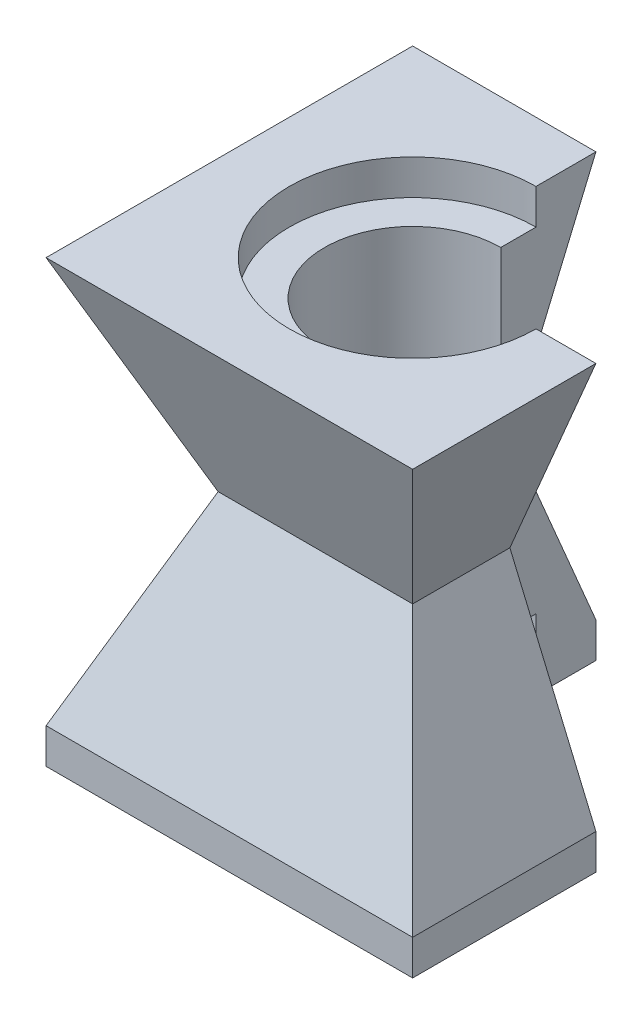
from build123d import *

# Parameters (mm, degrees)
SKETCH1_W           = 104
SKETCH1_H           = 104
BOSS_EXTRUDE1_DEPTH = 57.5
BOSS_EXTRUDE1_TAPER = 23
SKETCH1_3_R         = 25
CUT_EXTRUDE1_DEPTH  = 137.502747386
CUT_EXTRUDE2_DEPTH  = 10
CUT_EXTRUDE3_DEPTH  = 137.502747386
CUT_EXTRUDE4_DEPTH  = 10
BOSS_EXTRUDE2_DEPTH = 10


with BuildPart() as part:
    # Sketch1 → Boss-Extrude1 (new body)
    with BuildSketch(Plane(origin=(0, 0, 0), x_dir=(1, 0, 0), z_dir=(0, 1, 0))):
        Rectangle(SKETCH1_W, SKETCH1_H)
    boss_extrude1 = extrude(amount=BOSS_EXTRUDE1_DEPTH, taper=BOSS_EXTRUDE1_TAPER)

    # Mirror1: Boss-Extrude1 across plane
    add(boss_extrude1.mirror(Plane.ZX.offset(57.5)))

    # Sketch1<3> → Cut-Extrude1 (cut, through all)
    with BuildSketch(Plane(origin=(0, 0, 0), x_dir=(1, 0, 0), z_dir=(0, 1, 0))):
        Circle(SKETCH1_3_R)
    extrude(amount=CUT_EXTRUDE1_DEPTH, mode=Mode.SUBTRACT)

    # Sketch2 → Cut-Extrude2 (cut)
    with BuildSketch(Plane.XZ):
        with BuildLine():
            Line((0, -35), (0, -25))
            ThreePointArc((0, -25), (-17.67766953, 17.67766953), (25, 0))
            Line((25, 0), (35, 0))
            ThreePointArc((35, 0), (-24.748737342, 24.748737342), (0, -35))
        make_face()
    cut_extrude2 = extrude(amount=-CUT_EXTRUDE2_DEPTH, mode=Mode.SUBTRACT)

    # Sketch2<3> → Cut-Extrude3 (cut, through all)
    with BuildSketch(Plane.XZ):
        with BuildLine():
            Line((0, -25), (0, -35))
            Line((0, -35), (0, -52))
            Line((0, -52), (52, -52))
            Line((52, -52), (52, 0))
            Line((52, 0), (35, 0))
            Line((35, 0), (25, 0))
            ThreePointArc((25, 0), (17.67766953, -17.67766953), (0, -25))
        make_face()
    extrude(amount=-CUT_EXTRUDE3_DEPTH, mode=Mode.SUBTRACT)

    # Mirror2: Cut-Extrude2 across plane
    add(cut_extrude2.mirror(Plane(origin=(0, 57.5, 0), x_dir=(0, 0, 1), z_dir=(0, -1, 0))), mode=Mode.SUBTRACT)

    # Sketch3 → Cut-Extrude4 (cut)
    with BuildSketch(Plane.XZ):
        with BuildLine():
            Line((32.173358544, 27.930717857), (42.779960262, 38.537319575))
            ThreePointArc((42.779960262, 38.537319575), (42.779960262, 42.779960262), (38.537319575, 42.779960262))
            Line((38.537319575, 42.779960262), (27.930717857, 32.173358544))
            ThreePointArc((27.930717857, 32.173358544), (27.930717857, 27.930717857), (32.173358544, 27.930717857))
        make_face()
        with BuildLine():
            Line((-32.173358544, -27.930717857), (-42.779960262, -38.537319575))
            ThreePointArc((-42.779960262, -38.537319575), (-42.779960262, -42.779960262), (-38.537319575, -42.779960262))
            Line((-38.537319575, -42.779960262), (-27.930717857, -32.173358544))
            ThreePointArc((-27.930717857, -32.173358544), (-27.930717857, -27.930717857), (-32.173358544, -27.930717857))
        make_face()
        with BuildLine():
            Line((-27.930717857, 32.173358544), (-38.537319575, 42.779960262))
            ThreePointArc((-38.537319575, 42.779960262), (-42.779960262, 42.779960262), (-42.779960262, 38.537319575))
            Line((-42.779960262, 38.537319575), (-32.173358544, 27.930717857))
            ThreePointArc((-32.173358544, 27.930717857), (-27.930717857, 27.930717857), (-27.930717857, 32.173358544))
        make_face()
    extrude(amount=-CUT_EXTRUDE4_DEPTH, mode=Mode.SUBTRACT)

    # Sketch3<3> → Boss-Extrude2 (add)
    with BuildSketch(Plane.XZ):
        Polygon((0, -52), (0, -35), (-3, -35), (-3, -49), (-49, -49), (-49, 49), (49, 49), (49, 3), (35, 3), (35, 0), (52, 0), (52, 52), (-52, 52), (-52, -52), align=None)
    extrude(amount=BOSS_EXTRUDE2_DEPTH)


solid = part.part
